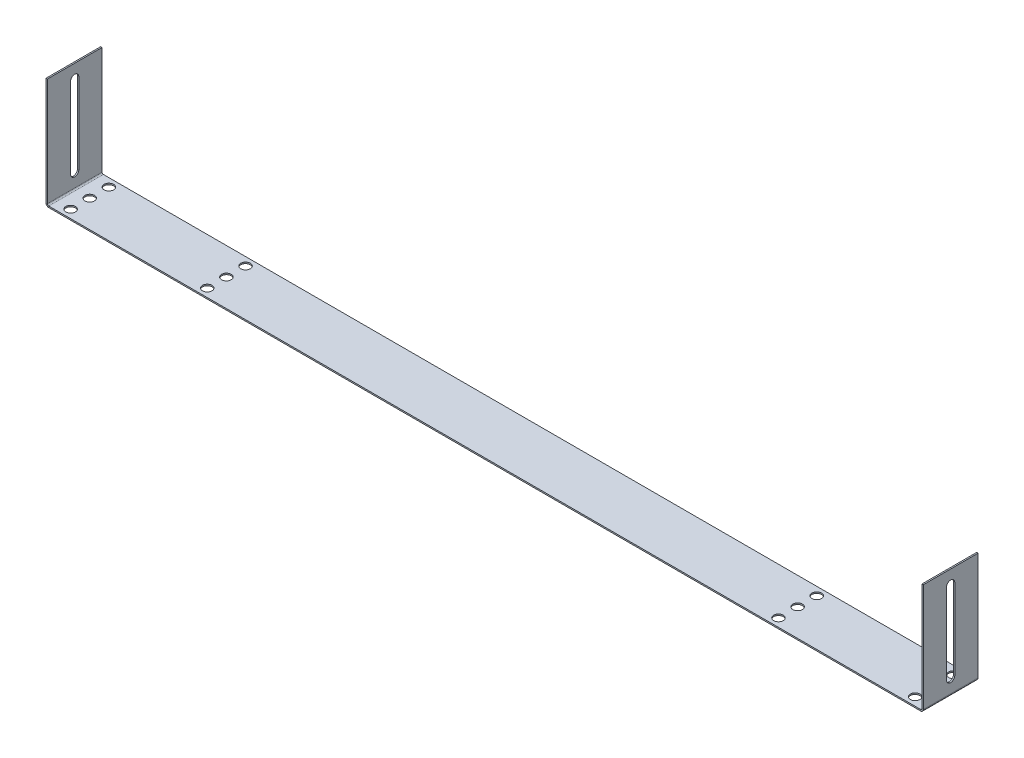
from build123d import *

# Parameters (mm, degrees)
BASE_FLANGE1_DEPTH = 40
CUT_EXTRUDE1_DEPTH = 649.200586239
SKETCH7_R          = 3.5
CUT_EXTRUDE2_DEPTH = 648.210166793


# Sheet-metal steps are written as plain solids
with BuildPart() as part:
    # Sketch1 → Base-Flange1 (new body)
    with BuildSketch(Plane.XY):
        with BuildLine():
            Line((0, 80), (0, 1))
            ThreePointArc((0, 1), (0.292893219, 0.292893219), (1, 0))
            Line((1, 0), (639, 0))
            ThreePointArc((639, 0), (639.707106781, 0.292893219), (640, 1))
            Line((640, 1), (640, 80))
            Line((640, 80), (641, 80))
            Line((641, 80), (641, 1))
            ThreePointArc((641, 1), (640.414213562, -0.414213562), (639, -1))
            Line((639, -1), (1, -1))
            ThreePointArc((1, -1), (-0.414213562, -0.414213562), (-1, 1))
            Line((-1, 1), (-1, 80))
            Line((-1, 80), (0, 80))
        make_face()
    extrude(amount=BASE_FLANGE1_DEPTH)

    # Sketch6 → Cut-Extrude1 (cut, through all)
    with BuildSketch(Plane(origin=(641, 0, 0), x_dir=(0, 0, -1), z_dir=(1, 0, 0))):
        with BuildLine():
            Line((-17, 70), (-17, 11))
            ThreePointArc((-17, 11), (-20, 8), (-23, 11))
            Line((-23, 11), (-23, 70))
            ThreePointArc((-23, 70), (-20, 73), (-17, 70))
        make_face()
    extrude(amount=-CUT_EXTRUDE1_DEPTH, mode=Mode.SUBTRACT)

    # Sketch7 → Cut-Extrude2 (cut, through all)
    with BuildSketch(Plane(origin=(0, 0, 0), x_dir=(1, 0, 0), z_dir=(0, 1, 0))):
        with Locations(Location((629, -20, 0), (0, 0, 270))):
            Circle(SKETCH7_R)
        with Locations(Location((629, -6, 0), (0, 0, 270))):
            Circle(SKETCH7_R)
        with Locations(Location((11, -20, 0), (0, 0, 90))):
            Circle(SKETCH7_R)
        with Locations(Location((11, -6, 0), (0, 0, 90))):
            Circle(SKETCH7_R)
        with Locations(Location((11, -34, 0), (0, 0, 270))):
            Circle(SKETCH7_R)
        with Locations(Location((629, -34, 0), (0, 0, 90))):
            Circle(SKETCH7_R)
        with Locations(Location((111, -34, 0), (0, 0, 90))):
            Circle(SKETCH7_R)
        with Locations(Location((111, -20, 0), (0, 0, 270))):
            Circle(SKETCH7_R)
        with Locations(Location((111, -6, 0), (0, 0, 270))):
            Circle(SKETCH7_R)
        with Locations(Location((529, -20, 0), (0, 0, 90))):
            Circle(SKETCH7_R)
        with Locations(Location((529, -34, 0), (0, 0, 270))):
            Circle(SKETCH7_R)
        with Locations(Location((529, -6, 0), (0, 0, 90))):
            Circle(SKETCH7_R)
    extrude(amount=-CUT_EXTRUDE2_DEPTH, mode=Mode.SUBTRACT)


solid = part.part
